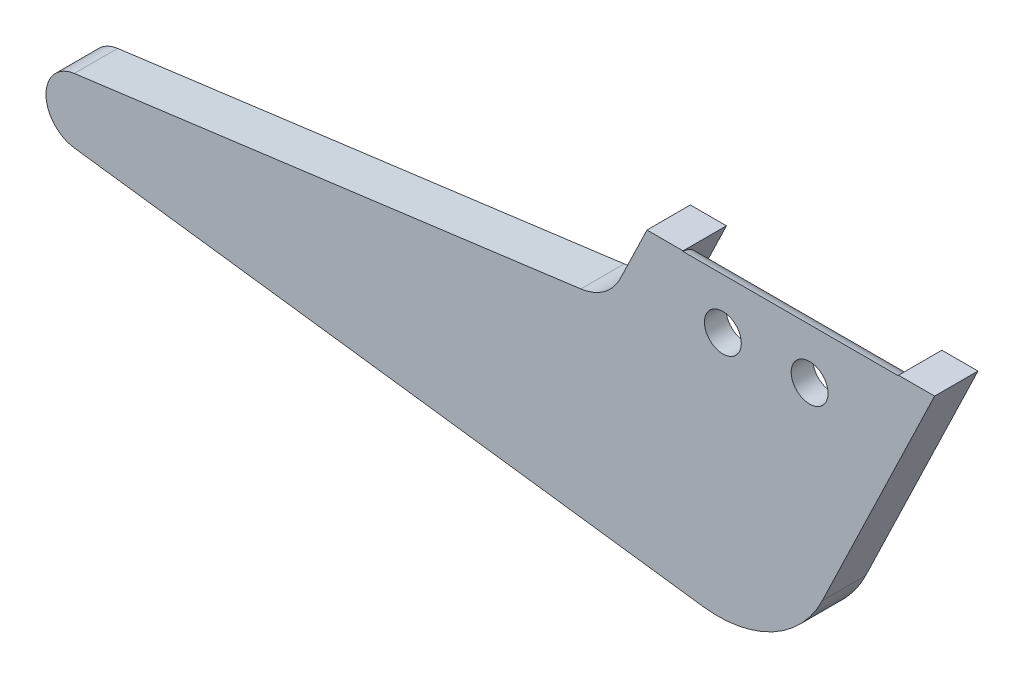
from build123d import *

# Parameters (mm, degrees)
ESQUISSE1_R        = 1.7
BOSS_EXTRU_1_DEPTH = 2
BOSS_EXTRU_2_START = -2
BOSS_EXTRU_2_DEPTH = 2
CONG_1_R           = 2.5


with BuildPart() as part:
    # Esquisse1 → Boss.-Extru.1 (new body)
    # profile 1 of 2: a face of its own
    with BuildSketch(Plane.XY):
        with BuildLine():
            Line((-6.298682213, 10.443854679), (-3.202171033, 16.875533229))
            Line((-3.202171033, 16.875533229), (-6.531753493, 16.875533229))
            Line((-6.531753493, 16.875533229), (-9.001723843, 11.745225474))
            ThreePointArc((-9.001723843, 11.745225474), (-10.480816133, 9.976643404), (-12.62301596, 9.124248871))
            Line((-12.62301596, 9.124248871), (-59.336252698, 2.974334584))
            ThreePointArc((-59.336252698, 2.974334584), (-61.944674121, 0), (-59.336252698, -2.974334584))
            Line((-59.336252698, -2.974334584), (-1.395824109, -10.602336719))
            ThreePointArc((-1.395824109, -10.602336719), (5.08555675, -9.407177121), (9.635283697, -4.638876688))
            Line((9.635283697, -4.638876688), (19.993327919, 16.875533229))
            Line((19.993327919, 16.875533229), (16.663745459, 16.875533229))
            Line((16.663745459, 16.875533229), (6.932242067, -3.337505893))
            ThreePointArc((6.932242067, -3.337505893), (3.658876225, -6.768127543), (-1.004245533, -7.628002135))
            Line((-1.004245533, -7.628002135), (-51.413902738, -0.991444861))
            ThreePointArc((-51.413902738, -0.991444861), (-52.283376546, 0), (-51.413902738, 0.991444861))
            Line((-51.413902738, 0.991444861), (-12.231437384, 6.149914287))
            ThreePointArc((-12.231437384, 6.149914287), (-8.721875965, 7.546390437), (-6.298682213, 10.443854679))
        make_face()
    # profile 2 of 2: a face of its own
    with BuildSketch(Plane.XY):
        with BuildLine():
            Line((16.663745459, 16.875533229), (-3.202171033, 16.875533229))
            Line((-3.202171033, 16.875533229), (-6.298682213, 10.443854679))
            ThreePointArc((-6.298682213, 10.443854679), (-8.721875965, 7.546390437), (-12.231437384, 6.149914287))
            Line((-12.231437384, 6.149914287), (-51.413902738, 0.991444861))
            ThreePointArc((-51.413902738, 0.991444861), (-52.283376546, 0), (-51.413902738, -0.991444861))
            Line((-51.413902738, -0.991444861), (-1.004245533, -7.628002135))
            ThreePointArc((-1.004245533, -7.628002135), (3.658876225, -6.768127543), (6.932242067, -3.337505893))
            Line((6.932242067, -3.337505893), (16.663745459, 16.875533229))
        make_face()
        with Locations((0.467987162, 12.175533229)):
            Circle(ESQUISSE1_R, mode=Mode.SUBTRACT)
        with Locations((8.467987162, 12.175533229)):
            Circle(ESQUISSE1_R, mode=Mode.SUBTRACT)
    extrude(amount=BOSS_EXTRU_1_DEPTH)

    # Esquisse1<5> → Boss.-Extru.2 (add)
    with BuildSketch(Plane.XY.offset(BOSS_EXTRU_2_START)):
        with BuildLine():
            Line((-6.298682213, 10.443854679), (-3.202171033, 16.875533229))
            Line((-3.202171033, 16.875533229), (-6.531753493, 16.875533229))
            Line((-6.531753493, 16.875533229), (-9.001723843, 11.745225474))
            ThreePointArc((-9.001723843, 11.745225474), (-10.480816133, 9.976643404), (-12.62301596, 9.124248871))
            Line((-12.62301596, 9.124248871), (-59.336252698, 2.974334584))
            ThreePointArc((-59.336252698, 2.974334584), (-61.944674121, 0), (-59.336252698, -2.974334584))
            Line((-59.336252698, -2.974334584), (-1.395824109, -10.602336719))
            ThreePointArc((-1.395824109, -10.602336719), (5.08555675, -9.407177121), (9.635283697, -4.638876688))
            Line((9.635283697, -4.638876688), (19.993327919, 16.875533229))
            Line((19.993327919, 16.875533229), (16.663745459, 16.875533229))
            Line((16.663745459, 16.875533229), (6.932242067, -3.337505893))
            ThreePointArc((6.932242067, -3.337505893), (3.658876225, -6.768127543), (-1.004245533, -7.628002135))
            Line((-1.004245533, -7.628002135), (-51.413902738, -0.991444861))
            ThreePointArc((-51.413902738, -0.991444861), (-52.283376546, 0), (-51.413902738, 0.991444861))
            Line((-51.413902738, 0.991444861), (-12.231437384, 6.149914287))
            ThreePointArc((-12.231437384, 6.149914287), (-8.721875965, 7.546390437), (-6.298682213, 10.443854679))
        make_face()
    extrude(amount=BOSS_EXTRU_2_DEPTH)

    # Congé1
    # the kernel refuses this fillet: 2.5 mm, written as the material it takes off along each edge
    with BuildSketch(Plane(origin=(22.913745459, 16.875533229, 0), x_dir=(0, 0, 1), z_dir=(-1, 0, 0))) as cong_1_piece_1_section:
        with BuildLine():
            CenterArc((CONG_1_R, -CONG_1_R), CONG_1_R, 90, 90)
            Line((0, -CONG_1_R), (0, 0))
            Line((0, 0), (CONG_1_R, 0))
        make_face()
    cong_1_piece_1 = extrude(amount=32.365916492, mode=Mode.PRIVATE)
    cong_1_piece_1 = split(cong_1_piece_1, bisect_by=Plane(origin=(14.522128014, 12.4272383, 0.565987786), z_dir=(-0.9010138766913354, 0.4337902650010155, 0)), keep=Keep.TOP, mode=Mode.PRIVATE)
    cong_1_piece_1 = split(cong_1_piece_1, bisect_by=Plane(origin=(-1.605539627, 20.191852587, 0.565987786), z_dir=(0.9010138766913354, -0.4337902650010154, 0)), keep=Keep.TOP, mode=Mode.PRIVATE)
    add(cong_1_piece_1, mode=Mode.SUBTRACT)


solid = part.part
